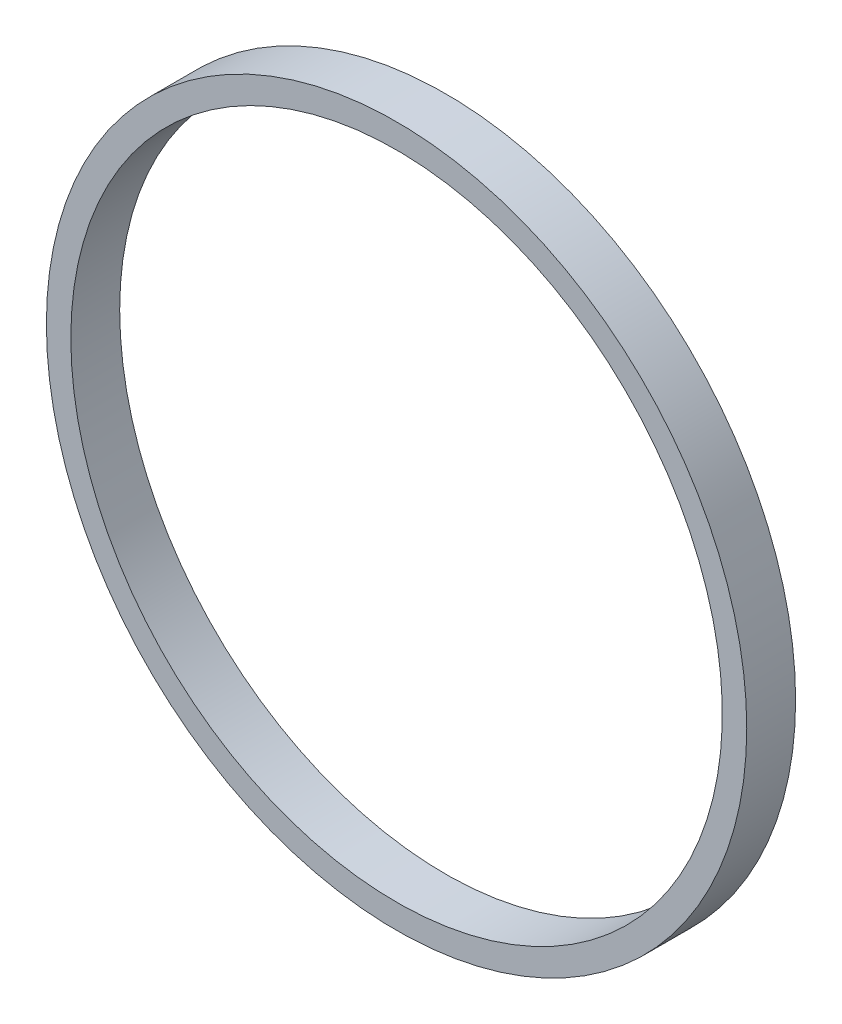
from build123d import *

# Parameters (mm, degrees)
SKETCH1_R           = 136.525
SKETCH1_R_2         = 127
BOSS_EXTRUDE1_DEPTH = 19.05


with BuildPart() as part:
    # Sketch1 → Boss-Extrude1 (new body)
    with BuildSketch(Plane.XY):
        Circle(SKETCH1_R)
        Circle(SKETCH1_R_2, mode=Mode.SUBTRACT)
    extrude(amount=BOSS_EXTRUDE1_DEPTH)


solid = part.part
